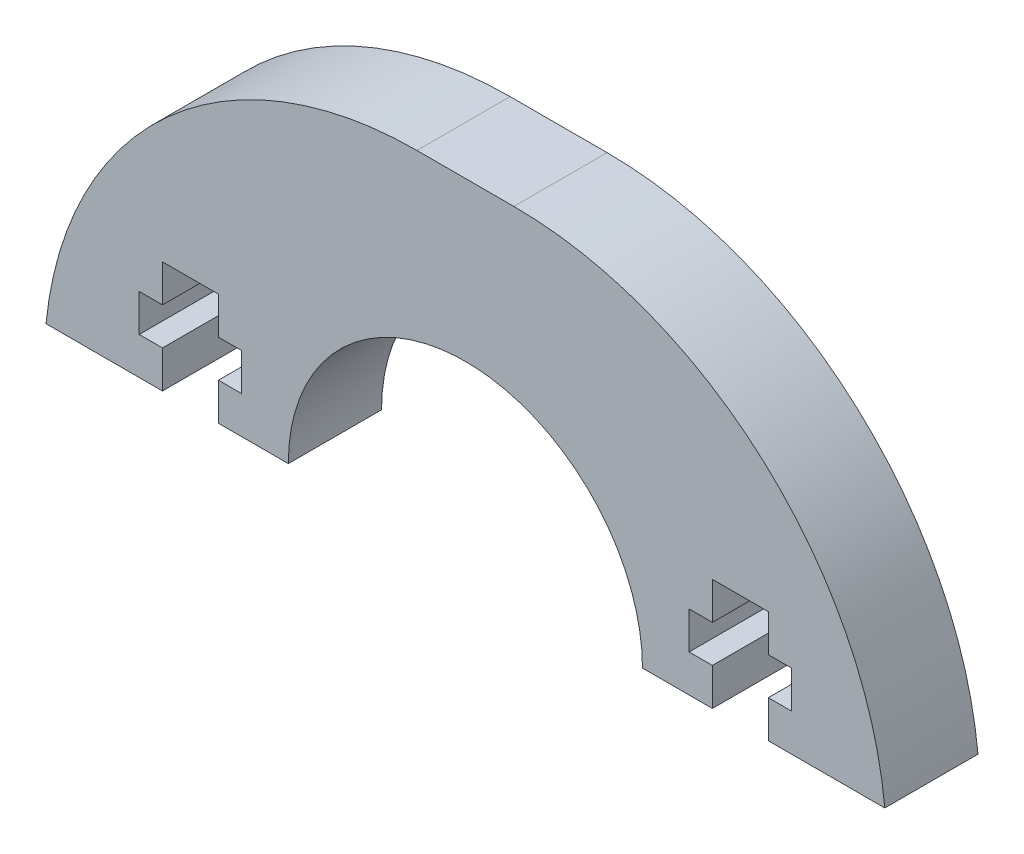
from build123d import *

# Parameters (mm, degrees)
BOSS_EXTRUDE1_DEPTH = 5
FILLET1_R           = 20


with BuildPart() as part:
    # Sketch1 → Boss-Extrude1 (new body)
    with BuildSketch(Plane.XY):
        with BuildLine():
            Line((13.25, -3), (16.25, -3))
            Line((16.25, -3), (16.25, -5))
            Line((16.25, -5), (17.5, -5))
            Line((17.5, -5), (17.5, -7))
            Line((17.5, -7), (16.25, -7))
            Line((16.25, -7), (16.25, -9))
            Line((16.25, -9), (22.5, -9))
            Line((22.5, -9), (22.5, 9))
            Line((22.5, 9), (-22.5, 9))
            Line((-22.5, 9), (-22.5, -9))
            Line((-22.5, -9), (-16.25, -9))
            Line((-16.25, -9), (-16.25, -7))
            Line((-16.25, -7), (-17.5, -7))
            Line((-17.5, -7), (-17.5, -5))
            Line((-17.5, -5), (-16.25, -5))
            Line((-16.25, -5), (-16.25, -3))
            Line((-16.25, -3), (-13.25, -3))
            Line((-13.25, -3), (-13.25, -5))
            Line((-13.25, -5), (-12, -5))
            Line((-12, -5), (-12, -7))
            Line((-12, -7), (-13.25, -7))
            Line((-13.25, -7), (-13.25, -9))
            Line((-13.25, -9), (-9.5, -9))
            ThreePointArc((-9.5, -9), (0, 0.5), (9.5, -9))
            Line((9.5, -9), (13.25, -9))
            Line((13.25, -9), (13.25, -7))
            Line((13.25, -7), (12, -7))
            Line((12, -7), (12, -5))
            Line((12, -5), (13.25, -5))
            Line((13.25, -5), (13.25, -3))
        make_face()
    extrude(amount=BOSS_EXTRUDE1_DEPTH)

    # Fillet1
    # the kernel refuses this fillet: 20 mm, written as the material it takes off along each edge
    with BuildSketch(Plane(origin=(22.5, 9, -49.749371855), x_dir=(0, -1, 0), z_dir=(0, 0, 1))) as fillet1_piece_1:
        with BuildLine():
            CenterArc((20, -19.899748742), FILLET1_R, 95.739170477, 84.260829523)
            Line((0, -19.899748742), (-0.4, -19.899748742))
            Line((-0.4, -19.899748742), (-0.4, 0))
            Line((-0.4, 0), (0, 0.4))
            ThreePointArc((0, 0.4), (9, 0.4), (17.96, 0.397994975))
            Line((17.96, 0.397994975), (18, 0))
        make_face()
    extrude(amount=104.498743711, mode=Mode.SUBTRACT)
    with BuildSketch(Plane(origin=(-22.5, 9, -49.749371855), x_dir=(1, 0, 0), z_dir=(0, 0, 1))) as fillet1_piece_2:
        with BuildLine():
            CenterArc((19.899748742, -20), FILLET1_R, 90, 84.260829523)
            Line((0, -18), (-0.397994975, -17.96))
            ThreePointArc((-0.397994975, -17.96), (-0.4, -9), (-0.4, 0))
            Line((-0.4, 0), (0, 0.4))
            Line((0, 0.4), (19.899748742, 0.4))
            Line((19.899748742, 0.4), (19.899748742, 0))
        make_face()
    extrude(amount=104.498743711, mode=Mode.SUBTRACT)


solid = part.part
